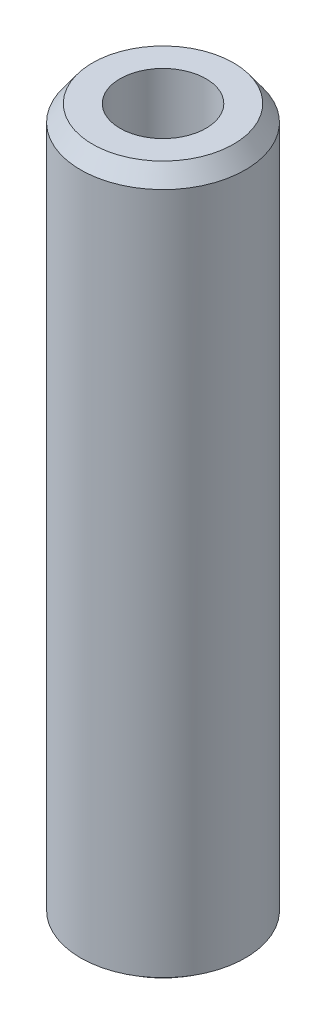
from build123d import *
from OCP.BRepFilletAPI import BRepFilletAPI_MakeChamfer

# Parameters (mm, degrees)
SKETCH1_R           = 15
BOSS_EXTRUDE1_DEPTH = 129.423228325
SKETCH2_R           = 7.830387622
CUT_EXTRUDE1_DEPTH  = 132.15018883
CHAMFER1_SIZE       = 2.973673273
CHAMFER1_SIZE2      = 2.15615645


with BuildPart() as part:
    # Sketch1 → Boss-Extrude1 (new body)
    with BuildSketch(Plane(origin=(0, 0, 0), x_dir=(1, 0, 0), z_dir=(0, 1, 0))):
        Circle(SKETCH1_R)
    extrude(amount=BOSS_EXTRUDE1_DEPTH)

    # Sketch2 → Cut-Extrude1 (cut, through all)
    with BuildSketch(Plane(origin=(0, 0, 0), x_dir=(1, 0, 0), z_dir=(0, 1, 0))):
        Circle(SKETCH2_R)
    extrude(amount=CUT_EXTRUDE1_DEPTH, mode=Mode.SUBTRACT)

    # Chamfer1: one chamfer whose edges measure the first distance from different faces: ONE call of the kernel's chamfer builder (chamfer() names one face for all edges)
    chamfer1_edges_1 = [part.edges().sort_by_distance(p)[0] for p in [
        (-15, 129.423228325, 0),
    ]]
    chamfer1_side_1 = [part.faces().sort_by_distance(p)[0] for p in [
        (-15, 64.711614162, 0),
    ]]
    chamfer1_edges_2 = [part.edges().sort_by_distance(p)[0] for p in [
        (-15, 0, 0),
    ]]
    chamfer1_side_2 = [part.faces().sort_by_distance(p)[0] for p in [
        (-14.575735931, 0, 0),
    ]]
    chamfer1 = BRepFilletAPI_MakeChamfer(part.part.solid().wrapped)
    for e in chamfer1_edges_1:
        chamfer1.Add(CHAMFER1_SIZE, CHAMFER1_SIZE2, e.wrapped, chamfer1_side_1[0].wrapped)  # the first distance lies on this face
    for e in chamfer1_edges_2:
        chamfer1.Add(CHAMFER1_SIZE, CHAMFER1_SIZE2, e.wrapped, chamfer1_side_2[0].wrapped)  # the first distance lies on this face
    add(Compound.cast(chamfer1.Shape()), mode=Mode.REPLACE)


solid = part.part
